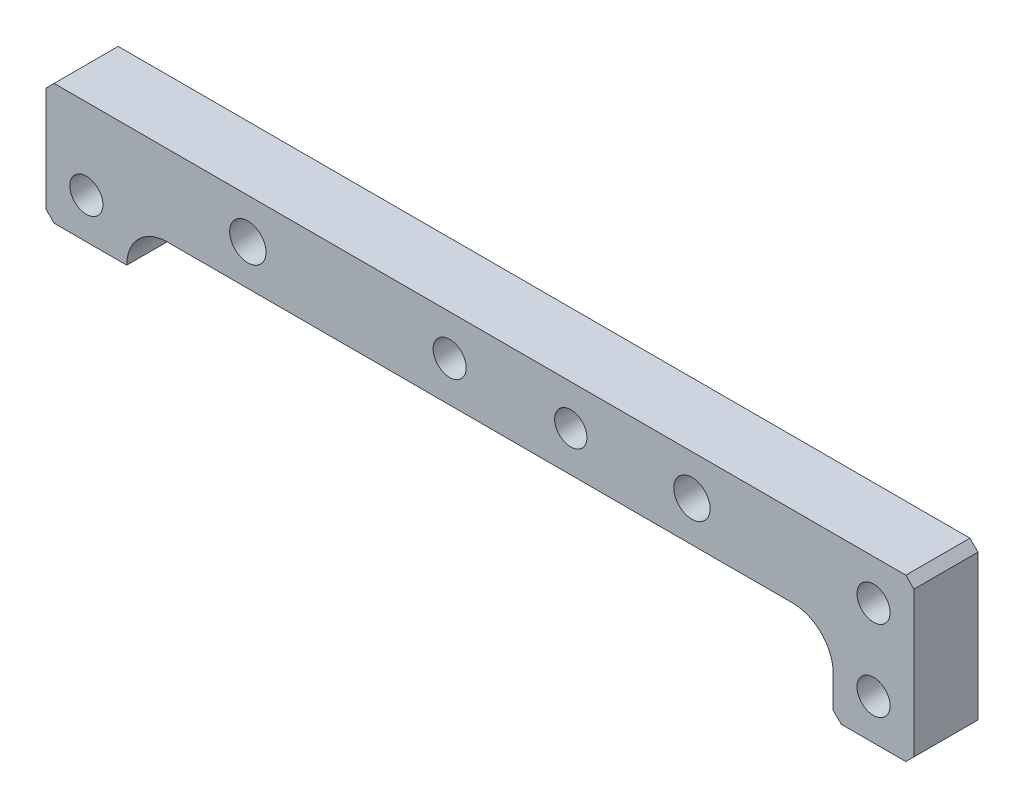
from build123d import *

# Parameters (mm, degrees)
SKETCH_1_R          = 4
SKETCH_1_R_2        = 4.1
EXTRUDE_1_DEPTH     = 15.875
FILLET_1_R          = 10
CHAMFER_1_SIZE      = 2
SKETCH_2_R          = 4.5
CUT_EXTRUDE_1_DEPTH = 20
SKETCH_3_R          = 4.5
CUT_EXTRUDE_2_DEPTH = 20


with BuildPart() as part:
    # 草图1 → 凸台-拉伸1 (new body)
    with BuildSketch(Plane.XY):
        Polygon((0, 10), (-130, 10), (-130, -20), (-110, -20), (-110, -10), (0, -10), (65, -10), (65, -30), (85, -30), (85, 10), align=None)
        Circle(SKETCH_1_R, mode=Mode.SUBTRACT)
        with Locations((-30, 0)):
            Circle(SKETCH_1_R_2, mode=Mode.SUBTRACT)
        with Locations((75, 0)):
            Circle(SKETCH_1_R_2, mode=Mode.SUBTRACT)
        with Locations((75, -20)):
            Circle(SKETCH_1_R_2, mode=Mode.SUBTRACT)
        with Locations((-120, -10)):
            Circle(SKETCH_1_R_2, mode=Mode.SUBTRACT)
    extrude(amount=EXTRUDE_1_DEPTH)

    # 圆角1
    fillet_1_edges = [part.edges().sort_by_distance(p)[0] for p in [
        (65, -10, 7.9375),
        (-110, -10, 7.9375),
    ]]
    fillet(fillet_1_edges, radius=FILLET_1_R - 0.0001)  # a hair under: the kernel refuses the full size

    # 倒角1
    chamfer_1_edges = [part.edges().sort_by_distance(p)[0] for p in [
        (-130, 10, 7.9375),
        (85, 10, 7.9375),
        (85, -30, 7.9375),
        (65, -30, 7.9375),
        (-130, -20, 7.9375),
    ]]
    chamfer(chamfer_1_edges, length=CHAMFER_1_SIZE)

    # 草图2 → 切除-拉伸1 (cut)
    with BuildSketch(Plane(origin=(0, 0, 0), x_dir=(-1, 0, 0), z_dir=(0, 0, -1))):
        with Locations((-30, 0)):
            Circle(SKETCH_2_R)
    extrude(amount=-CUT_EXTRUDE_1_DEPTH, mode=Mode.SUBTRACT)

    # 草图3 → 切除-拉伸2 (cut)
    with BuildSketch(Plane(origin=(0, 0, 0), x_dir=(-1, 0, 0), z_dir=(0, 0, -1))):
        with Locations((80, 0)):
            Circle(SKETCH_3_R)
    extrude(amount=-CUT_EXTRUDE_2_DEPTH, mode=Mode.SUBTRACT)


solid = part.part
